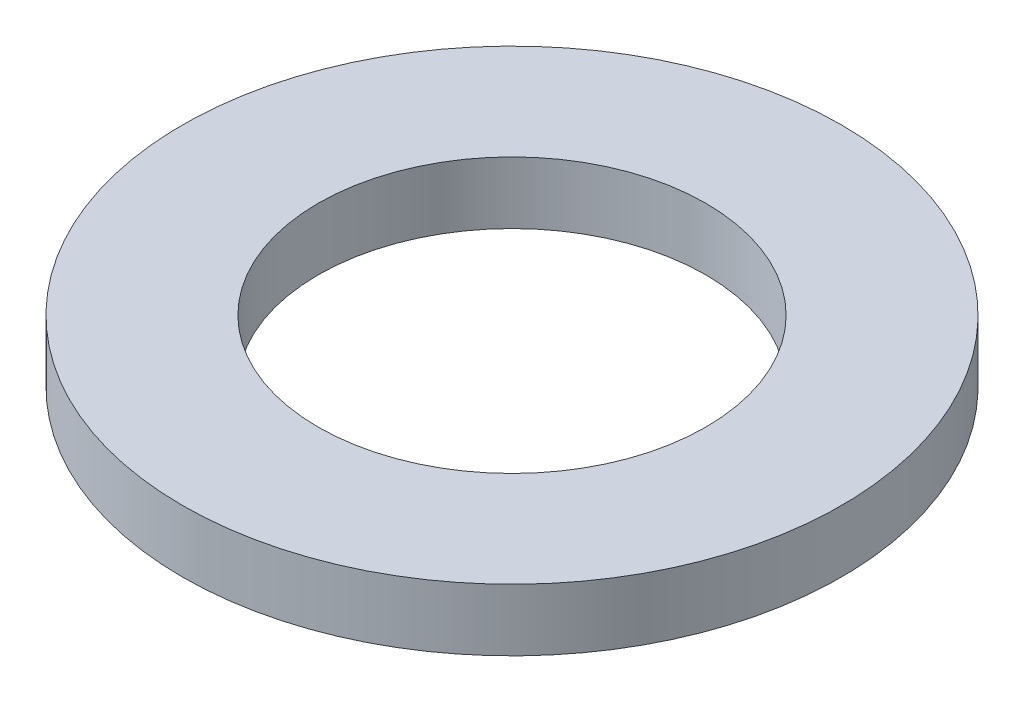
from build123d import *

# Parameters (mm, degrees)
SKETCH1_R           = 42.5
BOSS_EXTRUDE1_DEPTH = 8
SKETCH2_R           = 25
CUT_EXTRUDE1_DEPTH  = 61.634148794


with BuildPart() as part:
    # Sketch1 → Boss-Extrude1 (new body)
    with BuildSketch(Plane(origin=(0, 0, 0), x_dir=(1, 0, 0), z_dir=(0, 1, 0))):
        Circle(SKETCH1_R)
    extrude(amount=BOSS_EXTRUDE1_DEPTH)

    # Sketch2 → Cut-Extrude1 (cut, through all)
    with BuildSketch(Plane(origin=(0, 0, 0), x_dir=(1, 0, 0), z_dir=(0, 1, 0))):
        Circle(SKETCH2_R)
    extrude(amount=CUT_EXTRUDE1_DEPTH, mode=Mode.SUBTRACT)


solid = part.part
